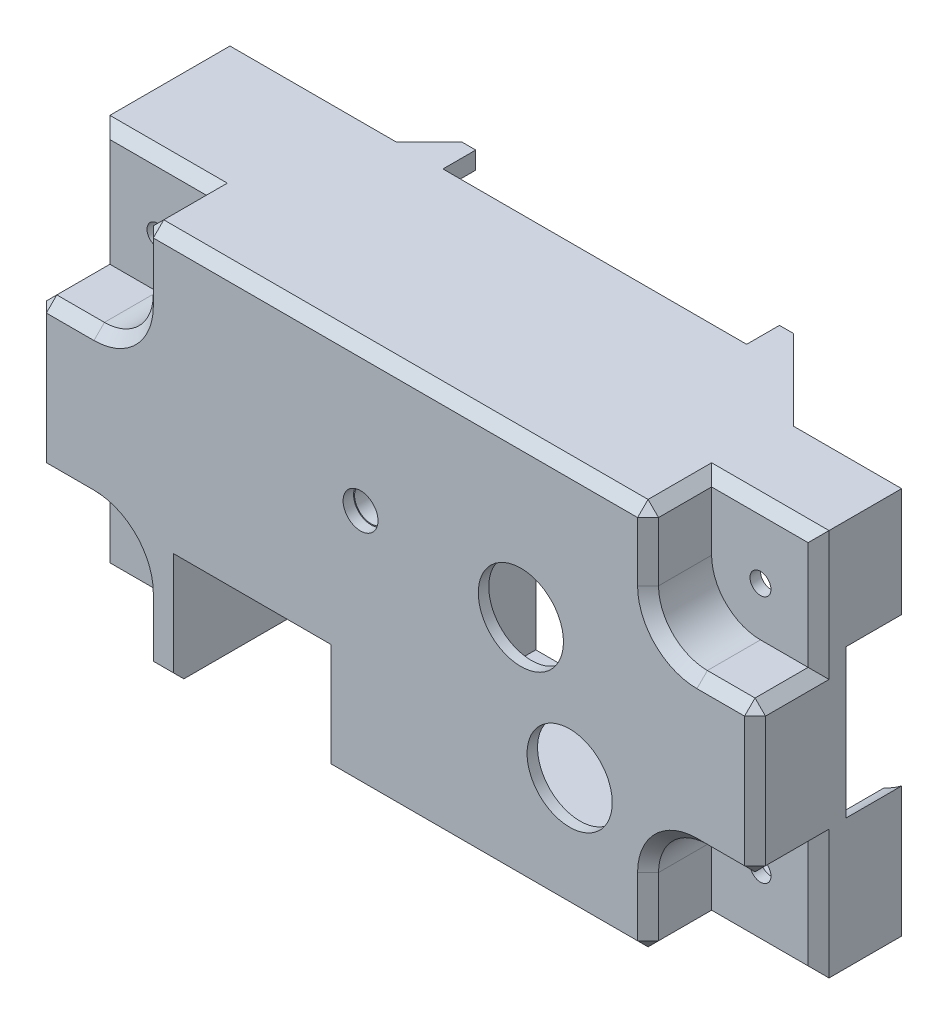
from build123d import *

# Parameters (mm, degrees)
SKETCH1_W            = 21
SKETCH1_H            = 9.5
SKETCH1_R            = 6.1
SKETCH1_R_2          = 2.5
SKETCH1_R_3          = 5
BOSS_EXTRUDE1_DEPTH  = 1.5
BOSS_EXTRUDE2_DEPTH  = 9.1
SKETCH3_R            = 1.5
BOSS_EXTRUDE3_DEPTH  = 1.5
SKETCH4_R            = 6.5
BOSS_EXTRUDE4_DEPTH  = 4
SKETCH5_R            = 6.5
SKETCH5_R_2          = 5.1
BOSS_EXTRUDE5_DEPTH  = 4
BOSS_EXTRUDE6_REACH  = 61.453
SKETCH6_W            = 2.5
SKETCH6_H            = 18.56
SKETCH6_W_2          = 69.36
SKETCH6_H_2          = 2.5
SKETCH6_3_W          = 69.36
SKETCH6_3_H          = 2.5
SKETCH6_3_W_2        = 2.5
SKETCH6_3_H_2        = 18.56
BOSS_EXTRUDE7_DEPTH  = 17.2
CUT_EXTRUDE1_DEPTH   = 81.655687958
SKETCH8_R            = 13.3
CUT_EXTRUDE2_DEPTH   = 8
BOSS_EXTRUDE8_DEPTH  = 2.5
CUT_EXTRUDE3_DEPTH   = 10.5
SKETCH12_W           = 22.6
SKETCH12_H           = 5.2
SKETCH12_H_2         = 11.1
SKETCH12_W_2         = 21
SKETCH12_H_3         = 9.5
CUT_EXTRUDE4_DEPTH   = 67.922062879
SKETCH13_W           = 22.6
SKETCH13_H           = 2.5
BOSS_EXTRUDE9_DEPTH  = 4.8
BOSS_EXTRUDE10_DEPTH = 26.3
BOSS_EXTRUDE11_DEPTH = 2
SKETCH16_R           = 3.35
SKETCH16_R_2         = 2.35
BOSS_EXTRUDE12_DEPTH = 20
FILLET1_R            = 8
CHAMFER1_SIZE        = 2
CHAMFER2_SIZE        = 1.5


with BuildPart() as part:
    # Sketch1 → Boss-Extrude1 (new body)
    with BuildSketch(Plane.XY):
        with BuildLine():
            Line((34.68, -27.75), (34.68, -17.78))
            ThreePointArc((34.68, -17.78), (37.16959236, -11.76959236), (43.18, -9.28))
            Line((43.18, -9.28), (51.5, -9.28))
            Line((51.5, -9.28), (51.5, 9.28))
            Line((51.5, 9.28), (43.18, 9.28))
            ThreePointArc((43.18, 9.28), (37.16959236, 11.76959236), (34.68, 17.78))
            Line((34.68, 17.78), (34.68, 27.75))
            Line((34.68, 27.75), (-34.68, 27.75))
            Line((-34.68, 27.75), (-34.68, 17.78))
            ThreePointArc((-34.68, 17.78), (-37.16959236, 11.76959236), (-43.18, 9.28))
            Line((-43.18, 9.28), (-51.5, 9.28))
            Line((-51.5, 9.28), (-51.5, -9.28))
            Line((-51.5, -9.28), (-43.18, -9.28))
            ThreePointArc((-43.18, -9.28), (-37.16959236, -11.76959236), (-34.68, -17.78))
            Line((-34.68, -17.78), (-34.68, -27.75))
            Line((-34.68, -27.75), (34.68, -27.75))
        make_face()
        with Locations((-20.5, -17)):
            Rectangle(SKETCH1_W, SKETCH1_H, mode=Mode.SUBTRACT)
        with Locations((24.95094926, -10.925598169)):
            Circle(SKETCH1_R, mode=Mode.SUBTRACT)
        with Locations((-5, 7.25)):
            Circle(SKETCH1_R_2, mode=Mode.SUBTRACT)
        with Locations((17.961885067, 5.51814586)):
            Circle(SKETCH1_R, mode=Mode.SUBTRACT)
        with Locations((43.5, 1.5)):
            Circle(SKETCH1_R_3, mode=Mode.SUBTRACT)
    extrude(amount=-BOSS_EXTRUDE1_DEPTH)

    # Sketch2 → Boss-Extrude2 (add)
    with BuildSketch(Plane.XY):
        with BuildLine():
            Line((34.68, 17.78), (34.68, 27.75))
            Line((34.68, 27.75), (36.18, 27.75))
            Line((36.18, 27.75), (36.18, 17.78))
            ThreePointArc((36.18, 17.78), (38.230252532, 12.830252532), (43.18, 10.78))
            Line((43.18, 10.78), (51.5, 10.78))
            Line((51.5, 10.78), (51.5, 9.28))
            Line((51.5, 9.28), (43.18, 9.28))
            ThreePointArc((43.18, 9.28), (37.16959236, 11.76959236), (34.68, 17.78))
        make_face()
        with BuildLine():
            Line((43.18, -9.28), (51.5, -9.28))
            Line((51.5, -9.28), (51.5, -10.78))
            Line((51.5, -10.78), (43.18, -10.78))
            ThreePointArc((43.18, -10.78), (38.230252532, -12.830252532), (36.18, -17.78))
            Line((36.18, -17.78), (36.18, -27.75))
            Line((36.18, -27.75), (34.68, -27.75))
            Line((34.68, -27.75), (34.68, -17.78))
            ThreePointArc((34.68, -17.78), (37.16959236, -11.76959236), (43.18, -9.28))
        make_face()
        with BuildLine():
            Line((-34.68, -17.78), (-34.68, -27.75))
            Line((-34.68, -27.75), (-36.18, -27.75))
            Line((-36.18, -27.75), (-36.18, -17.78))
            ThreePointArc((-36.18, -17.78), (-38.230252532, -12.830252532), (-43.18, -10.78))
            Line((-43.18, -10.78), (-51.5, -10.78))
            Line((-51.5, -10.78), (-51.5, -9.28))
            Line((-51.5, -9.28), (-43.18, -9.28))
            ThreePointArc((-43.18, -9.28), (-37.16959236, -11.76959236), (-34.68, -17.78))
        make_face()
        with BuildLine():
            Line((-34.68, 17.78), (-34.68, 27.75))
            Line((-34.68, 27.75), (-36.18, 27.75))
            Line((-36.18, 27.75), (-36.18, 17.78))
            ThreePointArc((-36.18, 17.78), (-38.230252532, 12.830252532), (-43.18, 10.78))
            Line((-43.18, 10.78), (-51.5, 10.78))
            Line((-51.5, 10.78), (-51.5, 9.28))
            Line((-51.5, 9.28), (-43.18, 9.28))
            ThreePointArc((-43.18, 9.28), (-37.16959236, 11.76959236), (-34.68, 17.78))
        make_face()
    extrude(amount=-BOSS_EXTRUDE2_DEPTH)

    # Sketch3 → Boss-Extrude3 (add)
    # profile 1 of 5: a face of its own
    with BuildSketch(Plane(origin=(0, 0, -9.1), x_dir=(-1, 0, 0), z_dir=(0, 0, -1))):
        with BuildLine():
            Line((36.18, -27.75), (36.18, -17.78))
            ThreePointArc((36.18, -17.78), (38.230252532, -12.830252532), (43.18, -10.78))
            Line((43.18, -10.78), (51.5, -10.78))
            Line((51.5, -10.78), (51.5, -9.28))
            Line((51.5, -9.28), (43.18, -9.28))
            ThreePointArc((43.18, -9.28), (37.16959236, -11.76959236), (34.68, -17.78))
            Line((34.68, -17.78), (34.68, -27.75))
            Line((34.68, -27.75), (36.18, -27.75))
        make_face()
    # profile 2 of 5: a face of its own
    with BuildSketch(Plane(origin=(0, 0, -9.1), x_dir=(-1, 0, 0), z_dir=(0, 0, -1))):
        with BuildLine():
            Line((51.5, -27.75), (51.5, -10.78))
            Line((51.5, -10.78), (43.18, -10.78))
            ThreePointArc((43.18, -10.78), (38.230252532, -12.830252532), (36.18, -17.78))
            Line((36.18, -17.78), (36.18, -27.75))
            Line((36.18, -27.75), (51.5, -27.75))
        make_face()
        with Locations((43.18, -17.78)):
            Circle(SKETCH3_R, mode=Mode.SUBTRACT)
    # profile 3 of 5: a face of its own
    with BuildSketch(Plane(origin=(0, 0, -9.1), x_dir=(-1, 0, 0), z_dir=(0, 0, -1))):
        with BuildLine():
            Line((-51.5, -27.75), (-34.68, -27.75))
            Line((-34.68, -27.75), (-34.68, -17.78))
            ThreePointArc((-34.68, -17.78), (-37.16959236, -11.76959236), (-43.18, -9.28))
            Line((-43.18, -9.28), (-51.5, -9.28))
            Line((-51.5, -9.28), (-51.5, -27.75))
        make_face()
        with Locations((-43.18, -17.78)):
            Circle(SKETCH3_R, mode=Mode.SUBTRACT)
    # profile 4 of 5: a face of its own
    with BuildSketch(Plane(origin=(0, 0, -9.1), x_dir=(-1, 0, 0), z_dir=(0, 0, -1))):
        with BuildLine():
            Line((-51.5, 27.75), (-51.5, 9.28))
            Line((-51.5, 9.28), (-43.18, 9.28))
            ThreePointArc((-43.18, 9.28), (-37.16959236, 11.76959236), (-34.68, 17.78))
            Line((-34.68, 17.78), (-34.68, 27.75))
            Line((-34.68, 27.75), (-51.5, 27.75))
        make_face()
        with Locations((-43.18, 17.78)):
            Circle(SKETCH3_R, mode=Mode.SUBTRACT)
    # profile 5 of 5: a face of its own
    with BuildSketch(Plane(origin=(0, 0, -9.1), x_dir=(-1, 0, 0), z_dir=(0, 0, -1))):
        with BuildLine():
            Line((51.5, 27.75), (34.68, 27.75))
            Line((34.68, 27.75), (34.68, 17.78))
            ThreePointArc((34.68, 17.78), (37.16959236, 11.76959236), (43.18, 9.28))
            Line((43.18, 9.28), (51.5, 9.28))
            Line((51.5, 9.28), (51.5, 27.75))
        make_face()
        with Locations((43.18, 17.78)):
            Circle(SKETCH3_R, mode=Mode.SUBTRACT)
    extrude(amount=BOSS_EXTRUDE3_DEPTH)

    # Sketch4 → Boss-Extrude4 (add)
    with BuildSketch(Plane.XY):
        with Locations((43.5, 1.5)):
            Circle(SKETCH4_R)
    extrude(amount=-BOSS_EXTRUDE4_DEPTH)

    # Sketch5 → Boss-Extrude5 (add)
    with BuildSketch(Plane(origin=(0, 0, -4), x_dir=(-1, 0, 0), z_dir=(0, 0, -1))):
        with Locations(Location((-43.5, 1.5, 0), (0, 0, 180))):
            Circle(SKETCH5_R)
        with Locations((-43.5, 1.5)):
            Circle(SKETCH5_R_2, mode=Mode.SUBTRACT)
    extrude(amount=BOSS_EXTRUDE5_DEPTH)

    # Boss-Extrude6: up to this face of the body (flat: up to its plane)
    boss_extrude6_end = Plane(part.part.faces().sort_by_distance((-1.67140732, 0.932149741, -1.5))[0])
    # Sketch6 → Boss-Extrude6 (add, up to the picked face)
    with BuildSketch(Plane(origin=(0, 0, -10.6), x_dir=(-1, 0, 0), z_dir=(0, 0, -1)), mode=Mode.PRIVATE) as boss_extrude6_sk1:
        with Locations((50.25, 0)):
            Rectangle(SKETCH6_W, SKETCH6_H)
    boss_extrude6_tool1 = split(extrude(boss_extrude6_sk1.sketch, amount=-BOSS_EXTRUDE6_REACH, mode=Mode.PRIVATE), bisect_by=boss_extrude6_end, keep=Keep.BOTH, mode=Mode.PRIVATE)
    # Sketch6 → Boss-Extrude6 (add, up to the picked face)
    with BuildSketch(Plane(origin=(0, 0, -10.6), x_dir=(-1, 0, 0), z_dir=(0, 0, -1)), mode=Mode.PRIVATE) as boss_extrude6_sk2:
        with Locations((0, 26.5)):
            Rectangle(SKETCH6_W_2, SKETCH6_H_2)
    boss_extrude6_tool2 = split(extrude(boss_extrude6_sk2.sketch, amount=-BOSS_EXTRUDE6_REACH, mode=Mode.PRIVATE), bisect_by=boss_extrude6_end, keep=Keep.BOTH, mode=Mode.PRIVATE)
    # Sketch6 → Boss-Extrude6 (add, up to the picked face)
    with BuildSketch(Plane(origin=(0, 0, -10.6), x_dir=(-1, 0, 0), z_dir=(0, 0, -1)), mode=Mode.PRIVATE) as boss_extrude6_sk3:
        with Locations((0, -26.5)):
            Rectangle(SKETCH6_W_2, SKETCH6_H_2)
    boss_extrude6_tool3 = split(extrude(boss_extrude6_sk3.sketch, amount=-BOSS_EXTRUDE6_REACH, mode=Mode.PRIVATE), bisect_by=boss_extrude6_end, keep=Keep.BOTH, mode=Mode.PRIVATE)
    # Sketch6 → Boss-Extrude6 (add, up to the picked face)
    with BuildSketch(Plane(origin=(0, 0, -10.6), x_dir=(-1, 0, 0), z_dir=(0, 0, -1)), mode=Mode.PRIVATE) as boss_extrude6_sk4:
        with Locations((-50.25, 0)):
            Rectangle(SKETCH6_W, SKETCH6_H)
    boss_extrude6_tool4 = split(extrude(boss_extrude6_sk4.sketch, amount=-BOSS_EXTRUDE6_REACH, mode=Mode.PRIVATE), bisect_by=boss_extrude6_end, keep=Keep.BOTH, mode=Mode.PRIVATE)
    add(boss_extrude6_tool1.solids().sort_by(Axis((-50.25, 0, -10.6), (0, 0, 1)))[0])
    add(boss_extrude6_tool2.solids().sort_by(Axis((0, 26.5, -10.6), (0, 0, 1)))[0])
    add(boss_extrude6_tool3.solids().sort_by(Axis((0, -26.5, -10.6), (0, 0, 1)))[0])
    add(boss_extrude6_tool4.solids().sort_by(Axis((50.25, 0, -10.6), (0, 0, 1)))[0])

    # Sketch6<3> → Boss-Extrude7 (add)
    with BuildSketch(Plane(origin=(0, 0, -10.6), x_dir=(-1, 0, 0), z_dir=(0, 0, -1))):
        Polygon((34.68, -27.75), (51.5, -27.75), (51.5, -9.28), (49, -9.28), (49, -25.25), (34.68, -25.25), align=None)
        with Locations((0, -26.5)):
            Rectangle(SKETCH6_3_W, SKETCH6_3_H)
        with Locations((50.25, 0)):
            Rectangle(SKETCH6_3_W_2, SKETCH6_3_H_2)
        Polygon((49, 9.28), (51.5, 9.28), (51.5, 27.75), (34.68, 27.75), (34.68, 25.25), (49, 25.25), align=None)
        with Locations((0, 26.5)):
            Rectangle(SKETCH6_3_W, SKETCH6_3_H)
        Polygon((-34.68, 25.25), (-34.68, 27.75), (-51.5, 27.75), (-51.5, 9.28), (-49, 9.28), (-49, 25.25), align=None)
        with Locations((-50.25, 0)):
            Rectangle(SKETCH6_3_W_2, SKETCH6_3_H_2)
        Polygon((-51.5, -27.75), (-34.68, -27.75), (-34.68, -25.25), (-49, -25.25), (-49, -9.28), (-51.5, -9.28), align=None)
    extrude(amount=BOSS_EXTRUDE7_DEPTH)

    # Sketch7 → Cut-Extrude1 (cut, through all)
    with BuildSketch(Plane.XZ.offset(27.75)):
        Polygon((24.5, -32.5), (36, -21), (60.978299978, -21), (60.978299978, -33.217912911), align=None)
    extrude(amount=-CUT_EXTRUDE1_DEPTH, mode=Mode.SUBTRACT)

    # Sketch8 → Cut-Extrude2 (cut)
    with BuildSketch(Plane(origin=(0, 0, -21), x_dir=(-1, 0, 0), z_dir=(0, 0, -1))):
        with Locations((-43.5, 1.5)):
            Circle(SKETCH8_R)
    extrude(amount=-CUT_EXTRUDE2_DEPTH, mode=Mode.SUBTRACT)

    # Sketch9 → Boss-Extrude8 (add)
    with BuildSketch(Plane(origin=(0, 27.75, 0), x_dir=(1, 0, 0), z_dir=(0, 1, 0))):
        Polygon((-27.7, 27.8), (-21, 27.8), (-21, 32.5), (-23, 32.5), align=None)
        Polygon((29.2, 27.8), (24.5, 32.5), (22.5, 32.5), (22.5, 27.8), align=None)
    extrude(amount=-BOSS_EXTRUDE8_DEPTH)

    # Sketch11 → Cut-Extrude3 (cut)
    with BuildSketch(Plane.ZY.offset(51.5)):
        with BuildLine():
            ThreePointArc((-21.8, 6.25), (-25.8, 10.25), (-29.8, 6.25))
            Line((-29.8, 6.25), (-29.8, -1.55))
            ThreePointArc((-29.8, -1.55), (-25.8, -5.55), (-21.8, -1.55))
            Line((-21.8, -1.55), (-21.8, 6.25))
        make_face()
    extrude(amount=-CUT_EXTRUDE3_DEPTH, mode=Mode.SUBTRACT)

    # Sketch12 → Cut-Extrude4 (cut, through all)
    # profile 1 of 3: a face of its own
    with BuildSketch(Plane.XY):
        with Locations((-20.5, -25.15)):
            Rectangle(SKETCH12_W, SKETCH12_H)
    # profile 2 of 3: a face of its own
    with BuildSketch(Plane.XY):
        with Locations((-20.5, -17)):
            Rectangle(SKETCH12_W, SKETCH12_H_2)
        with Locations((-20.5, -17)):
            Rectangle(SKETCH12_W_2, SKETCH12_H_3, mode=Mode.SUBTRACT)
    # profile 3 of 3: a face of its own
    with BuildSketch(Plane.XY):
        with Locations((-20.5, -17)):
            Rectangle(SKETCH12_W_2, SKETCH12_H_3)
    extrude(amount=-CUT_EXTRUDE4_DEPTH, mode=Mode.SUBTRACT)

    # Sketch13 → Boss-Extrude9 (add)
    with BuildSketch(Plane(origin=(0, 0, -27.8), x_dir=(-1, 0, 0), z_dir=(0, 0, -1))):
        with Locations((20.5, -26.5)):
            Rectangle(SKETCH13_W, SKETCH13_H)
    extrude(amount=-BOSS_EXTRUDE9_DEPTH)

    # Sketch14 → Boss-Extrude10 (add)
    with BuildSketch(Plane(origin=(0, 0, -1.5), x_dir=(-1, 0, 0), z_dir=(0, 0, -1))):
        Polygon((9.2, -11.45), (31.8, -11.45), (31.8, -25.25), (33.3, -25.25), (33.3, -9.95), (7.7, -9.95), (7.7, -25.25), (9.2, -25.25), align=None)
    extrude(amount=BOSS_EXTRUDE10_DEPTH)

    # Sketch15 → Boss-Extrude11 (add)
    with BuildSketch(Plane.XY.offset(-23)):
        Polygon((-10, -22.55), (-31, -22.55), (-31.8, -22.55), (-31.8, -25.25), (-9.2, -25.25), (-9.2, -22.55), align=None)
    extrude(amount=-BOSS_EXTRUDE11_DEPTH)

    # Sketch16 → Boss-Extrude12 (add)
    with BuildSketch(Plane(origin=(0, 0, -1.5), x_dir=(-1, 0, 0), z_dir=(0, 0, -1))):
        with Locations(Location((5, 7.25, 0), (0, 0, 180))):
            Circle(SKETCH16_R)
        with Locations((5, 7.25)):
            Circle(SKETCH16_R_2, mode=Mode.SUBTRACT)
    extrude(amount=BOSS_EXTRUDE12_DEPTH)

    # Fillet1
    fillet1_edges = [part.edges().sort_by_distance(p)[0] for p in [
        (-8.35, 7.25, -1.5),
    ]]
    fillet(fillet1_edges, radius=FILLET1_R)

    # Chamfer1
    # the kernel refuses this chamfer: 2 mm, written as the material it adds along each edge
    with BuildSketch(Plane(origin=(43.18, -17.78, -1.5), x_dir=(-1, 0, 0), z_dir=(0, -1, 0))) as chamfer1_piece_1:
        Polygon((8.5 + CHAMFER1_SIZE, 0), (8.5, CHAMFER1_SIZE), (8.5, 0), align=None)
    revolve(axis=Axis((43.18, -17.78, -1.5), (0, 0, -1)), revolution_arc=90)
    with BuildSketch(Plane(origin=(43.18, -9.28, -1.5), x_dir=(0, 0.9996219169112968, 0.02749587661058638), z_dir=(1, 0, 0)), Plane(origin=(49, 9.28, -1.5), x_dir=(0, -0.9996219169112968, 0.02749587661058638), z_dir=(-1, 0, 0)), Plane(origin=(-43.18, 9.28, -1.5), x_dir=(0, -0.9996219169112968, 0.02749587661058638), z_dir=(-1, 0, 0)), Plane(origin=(-49, -9.28, -1.5), x_dir=(0, 0.9996219169112968, 0.02749587661058638), z_dir=(1, 0, 0))) as chamfer1_piece_2:
        Polygon((CHAMFER1_SIZE * 0.999621916911, -CHAMFER1_SIZE * 0.0274958766106), (-CHAMFER1_SIZE * 0.0274958766106, -CHAMFER1_SIZE * 0.999621916911), (0, 0), align=None)
    extrude(amount=5.82)
    with BuildSketch(Plane(origin=(-49, -9.28, -1.5), x_dir=(0.9996219169112968, 0, 0.027495876610586403), z_dir=(0, 1, 0))) as chamfer1_piece_3:
        Polygon((CHAMFER1_SIZE * 0.999621916911, CHAMFER1_SIZE * 0.0274958766106), (-CHAMFER1_SIZE * 0.0274958766106, CHAMFER1_SIZE * 0.999621916911), (0, 0), align=None)
    extrude(amount=18.56)
    with BuildSketch(Plane(origin=(-34.68, 25.25, -1.5), x_dir=(0, -0.9996219169112968, 0.027495876610586403), z_dir=(1, 0, 0))) as chamfer1_piece_4:
        Polygon((CHAMFER1_SIZE * 0.999621916911, CHAMFER1_SIZE * 0.0274958766106), (-CHAMFER1_SIZE * 0.0274958766106, CHAMFER1_SIZE * 0.999621916911), (0, 0), align=None)
    extrude(amount=69.36)
    with BuildSketch(Plane(origin=(49, 3.179264361, -1.5), x_dir=(-0.9996219169112968, 0, 0.027495876610586403), z_dir=(0, -1, 0))) as chamfer1_piece_5:
        Polygon((CHAMFER1_SIZE * 0.999621916911, CHAMFER1_SIZE * 0.0274958766106), (-CHAMFER1_SIZE * 0.0274958766106, CHAMFER1_SIZE * 0.999621916911), (0, 0), align=None)
    extrude(amount=12.459264361)
    with BuildSketch(Plane(origin=(49, 9.28, -1.5), x_dir=(-0.9996219169112968, 0, 0.027495876610586403), z_dir=(0, -1, 0))) as chamfer1_piece_6:
        Polygon((CHAMFER1_SIZE * 0.999621916911, CHAMFER1_SIZE * 0.0274958766106), (-CHAMFER1_SIZE * 0.0274958766106, CHAMFER1_SIZE * 0.999621916911), (0, 0), align=None)
    extrude(amount=9.459264361)
    with BuildSketch(Plane(origin=(43.18, 17.78, -1.5), x_dir=(0, -1, 0), z_dir=(1, 0, 0))) as chamfer1_piece_7:
        Polygon((8.5 + CHAMFER1_SIZE, 0), (8.5, CHAMFER1_SIZE), (8.5, 0), align=None)
    revolve(axis=Axis((43.18, 17.78, -1.5), (0, 0, -1)), revolution_arc=90)
    with BuildSketch(Plane(origin=(34.68, 17.78, -1.5), x_dir=(-0.9996219169112968, 0, 0.027495876610586403), z_dir=(0, 1, 0)), Plane(origin=(-34.68, 25.25, -1.5), x_dir=(0.9996219169112968, 0, 0.027495876610586403), z_dir=(0, -1, 0)), Plane(origin=(-34.68, -17.78, -1.5), x_dir=(0.9996219169112968, 0, 0.027495876610586403), z_dir=(0, -1, 0)), Plane(origin=(34.68, -25.25, -1.5), x_dir=(-0.9996219169112968, 0, 0.027495876610586403), z_dir=(0, 1, 0))) as chamfer1_piece_8:
        Polygon((CHAMFER1_SIZE * 0.999621916911, -CHAMFER1_SIZE * 0.0274958766106), (-CHAMFER1_SIZE * 0.0274958766106, -CHAMFER1_SIZE * 0.999621916911), (0, 0), align=None)
    extrude(amount=7.47)
    with BuildSketch(Plane(origin=(34.68, -25.25, -1.5), x_dir=(0, 0.9996219169112968, 0.027495876610586403), z_dir=(-1, 0, 0))) as chamfer1_piece_9:
        Polygon((CHAMFER1_SIZE * 0.999621916911, CHAMFER1_SIZE * 0.0274958766106), (-CHAMFER1_SIZE * 0.0274958766106, CHAMFER1_SIZE * 0.999621916911), (0, 0), align=None)
    extrude(amount=42.38)
    with BuildSketch(Plane(origin=(-7.7, -9.95, -1.5), x_dir=(0.9996219169112968, 0, 0.02749587661058638), z_dir=(0, -1, 0))) as chamfer1_piece_10:
        Polygon((CHAMFER1_SIZE * 0.999621916911, -CHAMFER1_SIZE * 0.0274958766106), (-CHAMFER1_SIZE * 0.0274958766106, -CHAMFER1_SIZE * 0.999621916911), (0, 0), align=None)
    extrude(amount=15.3)
    with BuildSketch(Plane(origin=(-33.3, -9.95, -1.5), x_dir=(0, 0.9996219169112968, 0.02749587661058638), z_dir=(1, 0, 0))) as chamfer1_piece_11:
        Polygon((CHAMFER1_SIZE * 0.999621916911, -CHAMFER1_SIZE * 0.0274958766106), (-CHAMFER1_SIZE * 0.0274958766106, -CHAMFER1_SIZE * 0.999621916911), (0, 0), align=None)
    extrude(amount=25.6)
    with BuildSketch(Plane(origin=(-43.18, 17.78, -1.5), x_dir=(1, 0, 0), z_dir=(0, 1, 0))) as chamfer1_piece_12:
        Polygon((8.5 + CHAMFER1_SIZE, 0), (8.5, CHAMFER1_SIZE), (8.5, 0), align=None)
    revolve(axis=Axis((-43.18, 17.78, -1.5), (0, 0, -1)), revolution_arc=90)
    with BuildSketch(Plane(origin=(-43.18, -17.78, -1.5), x_dir=(0, 1, 0), z_dir=(-1, 0, 0))) as chamfer1_piece_13:
        Polygon((8.5 + CHAMFER1_SIZE, 0), (8.5, CHAMFER1_SIZE), (8.5, 0), align=None)
    revolve(axis=Axis((-43.18, -17.78, -1.5), (0, 0, -1)), revolution_arc=90)
    with BuildSketch(Plane(origin=(-33.3, -9.95, -1.5), x_dir=(0, 0.9996219169112968, 0.02749587661058638), z_dir=(1, 0, 0))) as chamfer1_piece_14a_section:
        Polygon((CHAMFER1_SIZE * 0.999621916911, -CHAMFER1_SIZE * 0.0274958766106), (-CHAMFER1_SIZE * 0.0274958766106, -CHAMFER1_SIZE * 0.999621916911), (0, 0), align=None)
    chamfer1_piece_14a = extrude(amount=30.743365976, mode=Mode.PRIVATE)
    chamfer1_piece_14a = split(chamfer1_piece_14a, bisect_by=Plane(origin=(-7.7, -9.290412746, -2.159587254), z_dir=(1, 0, 0)), keep=Keep.TOP, mode=Mode.PRIVATE)
    with BuildSketch(Plane(origin=(-7.7, -4.806634024, -1.5), x_dir=(0.9996219169112968, 0, 0.02749587661058638), z_dir=(0, -1, 0))) as chamfer1_piece_14b_section:
        Polygon((CHAMFER1_SIZE * 0.999621916911, -CHAMFER1_SIZE * 0.0274958766106), (-CHAMFER1_SIZE * 0.0274958766106, -CHAMFER1_SIZE * 0.999621916911), (0, 0), align=None)
    chamfer1_piece_14b = extrude(amount=20.443365976, mode=Mode.PRIVATE)
    chamfer1_piece_14b = split(chamfer1_piece_14b, bisect_by=Plane(origin=(-7.040412746, -9.95, -2.159587254), z_dir=(0, 1, 0)), keep=Keep.TOP, mode=Mode.PRIVATE)
    chamfer1_piece_14 = chamfer1_piece_14a & chamfer1_piece_14b
    add(chamfer1_piece_14)

    # Chamfer2
    chamfer2_edges = [part.edges().sort_by_distance(p)[0] for p in [
        (-36.18, -22.765, 0),
        (-47.34, -10.78, 0),
        (51.5, -10.78, -4.55),
        (36.18, -27.75, -4.55),
        (36.18, -22.765, 0),
        (38.230252532, -12.830252532, 0),
        (47.34, -10.78, 0),
        (-36.18, 27.75, -4.55),
        (-51.5, 10.78, -4.55),
        (-38.230252532, 12.830252532, 0),
        (-47.34, 10.78, 0),
        (-36.18, 22.765, 0),
        (-43.84, -27.75, -9.1),
        (-51.5, -19.265, -9.1),
        (51.5, -19.265, -9.1),
        (43.84, -27.75, -9.1),
        (51.5, 19.265, -9.1),
        (43.84, 27.75, -9.1),
        (-51.5, 19.265, -9.1),
        (-43.84, 27.75, -9.1),
        (-33.99, -27.75, 0),
        (-51.5, 0, 0),
        (0, 27.75, 0),
        (51.5, 0, 0),
        (13.49, -27.75, 0),
        (36.18, 27.75, -4.55),
        (51.5, 10.78, -4.55),
        (47.34, 10.78, 0),
        (38.230252532, 12.830252532, 0),
        (36.18, 22.765, 0),
        (-51.5, -10.78, -4.55),
        (-36.18, -27.75, -4.55),
        (-38.230252532, -12.830252532, 0),
    ]]
    chamfer(chamfer2_edges, length=CHAMFER2_SIZE)


solid = part.part
